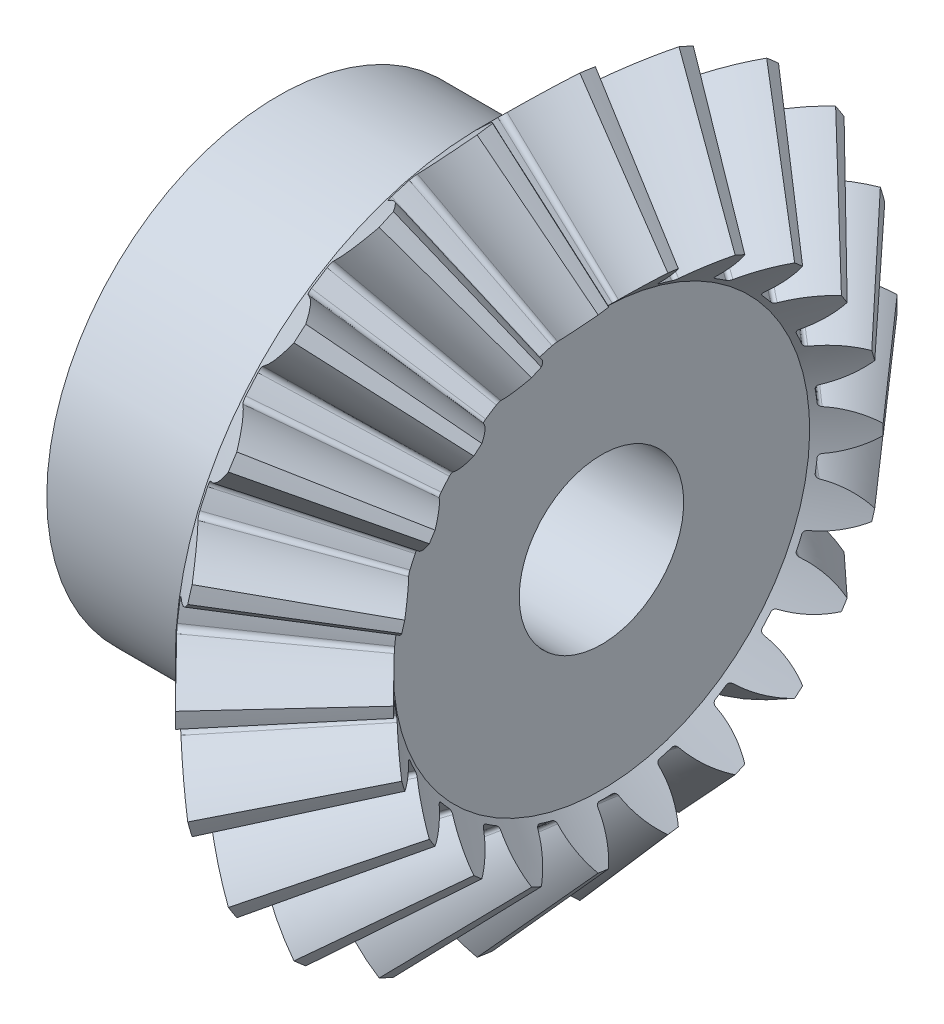
from build123d import *

# Parameters (mm, degrees)
TEETHCUTS_COUNT = 22
TEETHCUTS_ANGLE = 343.636363636
HUBSKE_R        = 22.5
HUB_DEPTH       = 19.849057006
BORSKE_R        = 8
BORE_DEPTH      = 56.0000508


with BuildPart() as part:
    # BasProSke → Base-Revolve (revolve)
    with BuildSketch(Plane(origin=(0, 0, 0), x_dir=(1, 0, 0), z_dir=(0, 1, 0)), mode=Mode.PRIVATE) as base_revolve_sk:
        Polygon((0, 0), (0, 29.848955409), (5.272364942, 35.121320342), (15.197148467, 23.832900433), (11.619385801, 20.255137773), (11.619385801, 0), align=None)
    revolve(base_revolve_sk.sketch.rotate(Axis((-10, 0, 0), (1, 0, 0)), 180), axis=Axis((-10, 0, 0), (1, 0, 0)))

    # ToothCut: read off the stored shape, not the designer's step
    # ToothCut: loft between two sections, ruled curve by curve
    toothcut_from = [
        Edge.make_bspline([(36.157178031, 0.006133434, -0.009276381), (36.152920227, 0.001875631, -0.014906828), (36.147119899, -0.003924697, -0.014087004), (36.143734256, -0.007310341, -0.007376226)], [0, 0, 0, 0, 1, 1, 1, 1], 3, [1, 0.772587086, 0.772587086, 1]),
        Edge.make_bspline([(36.143734256, -0.007310341, 0.007376226), (36.147119899, -0.003924697, 0.014087004), (36.152920227, 0.001875631, 0.014906828), (36.157178031, 0.006133434, 0.009276381)], [0, 0, 0, 0, 1, 1, 1, 1], 3, [1, 0.772587086, 0.772587086, 1]),
        Edge.make_bspline([(36.143734256, -0.007310341, -0.007376226), (36.143252246, -0.007792351, -0.00642082), (36.142867884, -0.008176713, -0.005380629), (36.142588496, -0.0084561, -0.004275481)], [0, 0, 0, 0, 1, 1, 1, 1], 3, [1, 0.993645628, 0.993645628, 1]),
        Edge.make_bspline([(36.142588496, -0.0084561, 0.004275481), (36.142867884, -0.008176713, 0.005380629), (36.143252246, -0.007792351, 0.00642082), (36.143734256, -0.007310341, 0.007376226)], [0, 0, 0, 0, 1, 1, 1, 1], 3, [1, 0.993645628, 0.993645628, 1]),
        Edge.make_bspline([(36.142588496, -0.0084561, -0.004275481), (36.141882508, -0.009162089, -0.001482864), (36.141882508, -0.009162089, 0.001482864), (36.142588496, -0.0084561, 0.004275481)], [0, 0, 0, 0, 1, 1, 1, 1], 3, [1, 0.961086077, 0.961086077, 1]),
        Edge.make_line((36.157178031, 0.006133434, 0.009276381), (36.157178031, 0.006133434, -0.009276381)),
    ]
    toothcut_to = [
        Edge.make_bspline([(5.561771996, 35.410727395, -4.766810649), (4.264107719, 34.11306312, -3.066384992), (2.684250769, 32.533206173, -1.940589005), (0.945742533, 30.79469794, -1.477457492)], [0, 0, 0, 0, 1, 1, 1, 1], 3, [1, 0.973934056, 0.973934056, 1]),
        Edge.make_bspline([(0.945742533, 30.79469794, 1.477457492), (2.684250769, 32.533206173, 1.940589005), (4.264107719, 34.11306312, 3.066384992), (5.561771996, 35.410727395, 4.766810649)], [0, 0, 0, 0, 1, 1, 1, 1], 3, [1, 0.973934056, 0.973934056, 1]),
        Edge.make_bspline([(0.945742533, 30.79469794, -1.477457492), (0.743163335, 30.592118743, -1.423491219), (0.614035236, 30.462990644, -1.1962449), (0.620372194, 30.469327602, -0.904853913)], [0, 0, 0, 0, 1, 1, 1, 1], 3, [1, 0.839916178, 0.839916178, 1]),
        Edge.make_bspline([(0.620372194, 30.469327602, 0.904853913), (0.614035236, 30.462990644, 1.1962449), (0.743163335, 30.592118743, 1.423491219), (0.945742533, 30.79469794, 1.477457492)], [0, 0, 0, 0, 1, 1, 1, 1], 3, [1, 0.839916178, 0.839916178, 1]),
        Edge.make_bspline([(0.620372194, 30.469327602, -0.904853913), (0.633488861, 30.482444269, -0.301713033), (0.633488861, 30.482444269, 0.301713033), (0.620372194, 30.469327602, 0.904853913)], [0, 0, 0, 0, 1, 1, 1, 1], 3, [1, 0.999684928, 0.999684928, 1]),
        Edge.make_line((5.561771996, 35.410727395, 4.766810649), (5.561771996, 35.410727395, -4.766810649)),
    ]
    toothcut = Solid(Shell([*[Face.make_surface_from_curves(toothcut_from[k], toothcut_to[k]) for k in range(6)], Face(Wire(toothcut_from)), Face(Wire(toothcut_to))]))
    add(toothcut, mode=Mode.SUBTRACT)

    # TeethCuts: ToothCut ×22 about axis
    teethcuts_axis = Axis((-10, 0, 0), (1, 0, 0))
    for i in range(1, TEETHCUTS_COUNT):
        add(toothcut.rotate(teethcuts_axis, i * TEETHCUTS_ANGLE / (TEETHCUTS_COUNT - 1)), mode=Mode.SUBTRACT)

    # HubSke → Hub (add)
    with BuildSketch(Plane.ZY):
        with Locations(Location((0, 0, 0), (0, 0, 180))):
            Circle(HUBSKE_R)
    extrude(amount=HUB_DEPTH)

    # BorSke → Bore (cut, symmetric)
    with BuildSketch(Plane(origin=(0, 0, 0), x_dir=(0, 0, -1), z_dir=(1, 0, 0))):
        with Locations(Location((0, 0, 0), (0, 0, 180))):
            Circle(BORSKE_R)
    extrude(amount=BORE_DEPTH, both=True, mode=Mode.SUBTRACT)


solid = part.part
